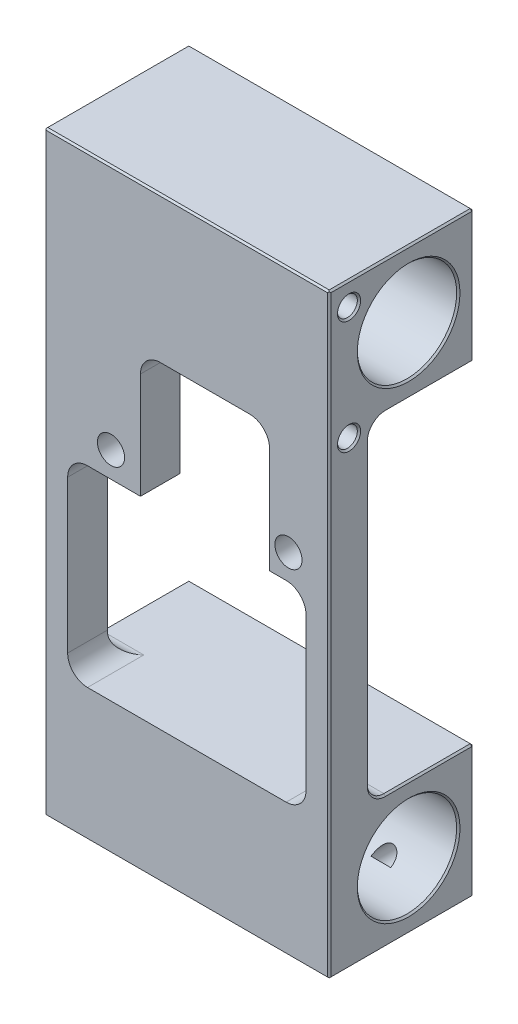
from build123d import *

# Parameters (mm, degrees)
MODEL_W                  = 43
MODEL_H                  = 90
MODEL_R                  = 2.05
EXTRUDE_1_DEPTH          = 21.8
FILLET_1_R               = 3
CUT_EXTRUDE_1_DEPTH      = 103.099167479
CUT_EXTRUDE_1_DEPTH_BACK = 103.099167479
FILLET_2_R               = 2.5
SKETCH_3_R               = 7.5
CUT_EXTRUDE_2_DEPTH      = 103.099167543
SKETCH_3_6_R             = 1.5
CUT_EXTRUDE_5_DEPTH      = 18
SKETCH_8_R               = 1.5
CUT_EXTRUDE_7_DEPTH      = 6
CHAMFER_3_SIZE           = 0.25
CHAMFER_4_SIZE           = 0.25


with BuildPart() as part:
    # Model → Бобышка-Вытянуть1 (new body)
    with BuildSketch(Plane.XY):
        with Locations((21.5, 45)):
            Rectangle(MODEL_W, MODEL_H)
        with Locations((10.05, 52.85)):
            Circle(MODEL_R, mode=Mode.SUBTRACT)
        with Locations((36.85, 52.85)):
            Circle(MODEL_R, mode=Mode.SUBTRACT)
        Polygon((14.5, 49), (14.5, 68), (34, 68), (34, 49), (39.5, 49), (39.5, 20), (3.5, 20), (3.5, 49), align=None, mode=Mode.SUBTRACT)
    extrude(amount=EXTRUDE_1_DEPTH)

    # Скругление1
    fillet_1_edges = [part.edges().sort_by_distance(p)[0] for p in [
        (3.5, 49, 10.9),
        (3.5, 20, 10.9),
        (39.5, 20, 10.9),
        (39.5, 49, 10.9),
        (34, 68, 10.9),
        (14.5, 68, 10.9),
    ]]
    fillet(fillet_1_edges, radius=FILLET_1_R)

    # Эскиз2 → Вырез-Вытянуть1 (cut, two sides: drawn at the far end of the back side and taken through both)
    with BuildSketch(Plane(origin=(43, 0, 0), x_dir=(0, 0, -1), z_dir=(1, 0, 0)).offset(-CUT_EXTRUDE_1_DEPTH_BACK)):
        Polygon((156.632056522, 70), (0, 70), (-15.8, 70), (-15.8, 20), (0, 20), (156.632056522, 20), (469.896169567, 20), (469.896169567, 70), align=None)
    extrude(amount=CUT_EXTRUDE_1_DEPTH + CUT_EXTRUDE_1_DEPTH_BACK, mode=Mode.SUBTRACT)

    # Скругление2
    fillet_2_edges = [part.edges().sort_by_distance(p)[0] for p in [
        (21.5, 70, 15.8),
        (3.25, 20, 15.8),
        (39.75, 20, 15.8),
    ]]
    fillet(fillet_2_edges, radius=FILLET_2_R - 0.0001)  # a hair under: the kernel refuses the full size

    # Эскиз3 → Вырез-Вытянуть2 (cut, through all)
    with BuildSketch(Plane(origin=(43, 0, 0), x_dir=(0, 0, -1), z_dir=(1, 0, 0))):
        with Locations(Location((-9.8, 80, 0), (0, 0, 90))):
            Circle(SKETCH_3_R)
        with Locations(Location((-9.8, 10, 0), (0, 0, 90))):
            Circle(SKETCH_3_R)
    extrude(amount=-CUT_EXTRUDE_2_DEPTH, mode=Mode.SUBTRACT)

    # Эскиз3<6> → Вырез-Вытянуть5 (cut)
    with BuildSketch(Plane(origin=(43, 0, 0), x_dir=(0, 0, -1), z_dir=(1, 0, 0))):
        with Locations(Location((-18.8, 86.5, 0), (0, 0, 90))):
            Circle(SKETCH_3_6_R)
        with Locations(Location((-18.8, 69.4, 0), (0, 0, 90))):
            Circle(SKETCH_3_6_R)
    extrude(amount=-CUT_EXTRUDE_5_DEPTH, mode=Mode.SUBTRACT)

    # Эскиз8 → Вырез-Вытянуть7 (cut)
    with BuildSketch(Plane(origin=(0, 0, 0), x_dir=(-1, 0, 0), z_dir=(0, 0, -1))):
        with Locations((-35, 86.5)):
            Circle(SKETCH_8_R)
        with Locations(Location((-8, 86.5, 0), (0, 0, 358.703677977))):
            Circle(SKETCH_8_R)
        with Locations((-8, 3.5)):
            Circle(SKETCH_8_R)
        with Locations(Location((-35, 3.5, 0), (0, 0, 1.296322023))):
            Circle(SKETCH_8_R)
    extrude(amount=-CUT_EXTRUDE_7_DEPTH, mode=Mode.SUBTRACT)

    # Фаска3
    chamfer_3_edges = [part.edges().sort_by_distance(p)[0] for p in [
        (43, 80, 0),
        (43, 70, 6.65005),
        (0, 10, 0),
        (0, 20, 6.65005),
        (21.5, 70, 0),
        (0, 70, 6.65005),
        (43, 45, 21.8),
        (0, 45, 15.8),
        (43, 45, 15.8),
        (43, 20, 6.65005),
        (0, 69.267796242, 15.067796242),
        (43, 69.267796242, 15.067796242),
        (43, 20.732203758, 15.067796242),
        (0, 20.732203758, 15.067796242),
        (43, 2.5, 9.8),
        (0, 2.5, 9.8),
        (0, 72.5, 9.8),
        (43, 72.5, 9.8),
        (43, 85, 18.8),
        (43, 67.9, 18.8),
        (36.5, 86.5, 0),
        (9.499616095, 86.533934736, 0),
        (9.5, 3.5, 0),
        (36.499616095, 3.466065264, 0),
        (43, 10, 0),
        (21.5, 0, 0),
        (21.5, 20, 0),
        (0, 80, 0),
        (21.5, 90, 0),
        (0, 45, 21.8),
        (43, 90, 10.9),
        (43, 0, 10.9),
        (0, 0, 10.9),
        (0, 90, 10.9),
    ]]
    chamfer(chamfer_3_edges, length=CHAMFER_3_SIZE)

    # Фаска4
    chamfer_4_edges = [part.edges().sort_by_distance(p)[0] for p in [
        (21.5, 90, 21.8),
        (21.5, 0, 21.8),
    ]]
    chamfer(chamfer_4_edges, length=CHAMFER_4_SIZE)


solid = part.part
